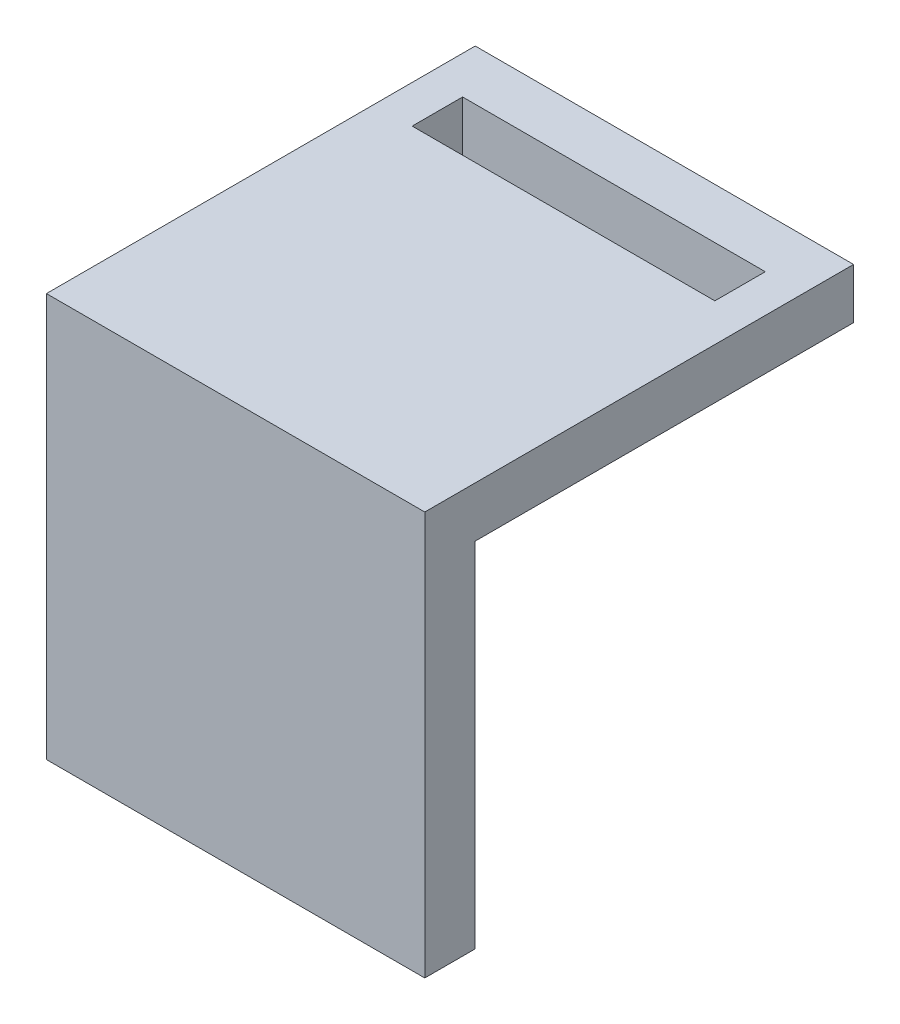
from build123d import *

# Parameters (mm, degrees)
SKETCH1_W           = 38.1
SKETCH1_H           = 35.56
BOSS_EXTRUDE1_DEPTH = 5.08
SKETCH2_W           = 38.1
SKETCH2_H           = 43.18
BOSS_EXTRUDE2_DEPTH = 5.08
CAVITY2_START       = -133.272192899
CAVITY2_OUTLINE_W   = 5.08
CAVITY2_OUTLINE_H   = 5.08
CAVITY2_DEPTH       = 30.48


# Read off the part's stored shape, not the designer's step: Cavity2
with BuildPart() as part:
    # Sketch1 → Boss-Extrude1 (new body)
    with BuildSketch(Plane.XY):
        with Locations((-118.032192899, 3.115408086)):
            Rectangle(SKETCH1_W, SKETCH1_H)
    extrude(amount=BOSS_EXTRUDE1_DEPTH)

    # Sketch2 → Boss-Extrude2 (add)
    with BuildSketch(Plane(origin=(0, 20.895408086, 0), x_dir=(1, 0, 0), z_dir=(0, 1, 0))):
        with Locations((-118.032192899, 16.51)):
            Rectangle(SKETCH2_W, SKETCH2_H)
    extrude(amount=BOSS_EXTRUDE2_DEPTH)

    # Cavity2 outline → Cavity2 (cut)
    with BuildSketch(Plane.YZ.offset(CAVITY2_START)):
        with Locations((23.435408086, -30.48)):
            Rectangle(CAVITY2_OUTLINE_W, CAVITY2_OUTLINE_H)
    extrude(amount=CAVITY2_DEPTH, mode=Mode.SUBTRACT)


solid = part.part
